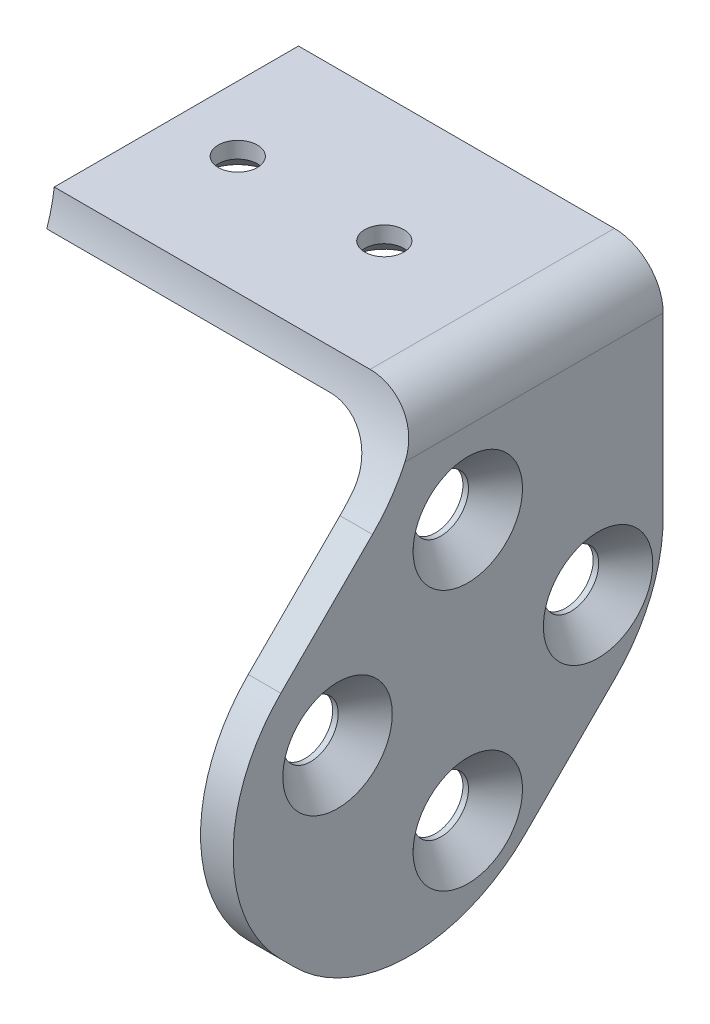
from build123d import *

# Parameters (mm, degrees)
ESBO_O1_W                                    = 22.4
ESBO_O1_H                                    = 15
RESSALTO_EXTRUS_O1_DEPTH                     = 2
ESBO_O9_W                                    = 2
ESBO_O9_H                                    = 15
RESSALTO_EXTRUS_O2_DEPTH                     = 1
INCLINA_O2_ANGLE                             = 45
ESBO_O11_W                                   = 2
ESBO_O11_H                                   = 21.213203436
RESSALTO_EXTRUS_O4_DEPTH                     = 22
FILETE1_START                                = 20.4
FILETE1_DEPTH                                = 2
FILETE1_2_DEPTH                              = 22.4
FILETE1_3_DEPTH                              = 2
ESCAREADO_PARA_SFHCS_M31_D                   = 3.4
ESCAREADO_PARA_SFHCS_M31_DEPTH               = 7.5
ESCAREADO_PARA_SFHCS_M31_CSINK_D             = 6.72
ESCAREADO_PARA_SFHCS_M31_CSINK_ANGLE         = 90
ESCAREADO_PARA_SFHCS_M31_TIP                 = 1.021463052
FILETE2_R                                    = 3
ESCAREADO_PARA_PARAFUSO_COM_CABE_A_E_2_COUNT = 2
ESCAREADO_PARA_PARAFUSO_COM_CABE_A_E_2_PITCH = 9


with BuildPart() as part:
    # Esboço1 → Ressalto-extrusão1 (new body)
    with BuildSketch(Plane(origin=(0, 0, 0), x_dir=(1, 0, 0), z_dir=(0, 1, 0))):
        with Locations((11.2, 7.5)):
            Rectangle(ESBO_O1_W, ESBO_O1_H)
    extrude(amount=RESSALTO_EXTRUS_O1_DEPTH)

    # Esboço9 → Ressalto-extrusão2 (add)
    with BuildSketch(Plane.XZ):
        with Locations((21.4, -7.5)):
            Rectangle(ESBO_O9_W, ESBO_O9_H)
    extrude(amount=RESSALTO_EXTRUS_O2_DEPTH)

    # Inclinação2
    inclina_o2_faces = [part.faces().sort_by_distance(p)[0] for p in [
        (21.4, -1, -7.5),
    ]]
    draft(inclina_o2_faces, Plane(origin=(0, 2, 0), x_dir=(1, 0, 0), z_dir=(0, 0, 1)), INCLINA_O2_ANGLE)

    # Esboço11 → Ressalto-extrusão4 (add)
    with BuildSketch(Plane(origin=(0, -0.5, 0.5), x_dir=(1, 0, 0), z_dir=(0, -0.7071067811865462, 0.7071067811865488))):
        with Locations((21.4, -11.313708499)):
            Rectangle(ESBO_O11_W, ESBO_O11_H)
    extrude(amount=RESSALTO_EXTRUS_O4_DEPTH)

    # Filete1: read off the stored shape, not the designer's step
    # Filete1 outline → Filete1 (cut)
    with BuildSketch(Plane.YZ.offset(FILETE1_START)):
        with BuildLine():
            ThreePointArc((-23.627416998, 8.485281374), (-16.556349186, 11.414213562), (-9.485281374, 8.485281374))
            Line((-9.485281374, 8.485281374), (-16.556349186, 15.556349186))
            Line((-16.556349186, 15.556349186), (-23.627416998, 8.485281374))
        make_face()
        with BuildLine():
            Line((-16, -15), (-11.857864376, -15))
            ThreePointArc((-11.857864376, -15), (-15.6846987, -14.238795325), (-18.928932188, -12.071067812))
            Line((-18.928932188, -12.071067812), (-16, -15))
        make_face()
        with BuildLine():
            ThreePointArc((-24.485281374, -6.514718626), (-27.414213562, 0.556349186), (-24.485281374, 7.627416998))
            Line((-24.485281374, 7.627416998), (-31.556349186, 0.556349186))
            Line((-31.556349186, 0.556349186), (-24.485281374, -6.514718626))
        make_face()
    extrude(amount=FILETE1_DEPTH, mode=Mode.SUBTRACT)

    # Filete1 2 outline → Filete1 2 (add)
    with BuildSketch(Plane.YZ):
        with BuildLine():
            Line((0, 0), (2, 0))
            ThreePointArc((2, 0), (0.988246282, 0.177135355), (0, 0.457120724))
            Line((0, 0.457120724), (0, 0))
        make_face()
    extrude(amount=FILETE1_2_DEPTH)

    # Filete1 3 outline → Filete1 3 (add)
    with BuildSketch(Plane.YZ.offset(FILETE1_START)):
        with BuildLine():
            Line((0, 0), (0, 0.457120724))
            ThreePointArc((0, 0.457120724), (-2.065182242, 1.434278965), (-3.854676043, 2.854676043))
            Line((-3.854676043, 2.854676043), (-1, 0))
            Line((-1, 0), (0, 0))
        make_face()
    extrude(amount=FILETE1_3_DEPTH)

    # Escareado para SFHCS M31
    with Locations(Plane(origin=(22.4, 0, 0), x_dir=(0, 0, -1), z_dir=(1, 0, 0))):
        with Locations((3, -6), (11, -14), (3, -22), (-5, -14)):
            CounterSinkHole(ESCAREADO_PARA_SFHCS_M31_D / 2, ESCAREADO_PARA_SFHCS_M31_CSINK_D / 2, depth=ESCAREADO_PARA_SFHCS_M31_DEPTH, counter_sink_angle=ESCAREADO_PARA_SFHCS_M31_CSINK_ANGLE)
            with Locations((0, 0, -(ESCAREADO_PARA_SFHCS_M31_DEPTH + ESCAREADO_PARA_SFHCS_M31_TIP / 2))):  # 118° drill point
                Cone(0, ESCAREADO_PARA_SFHCS_M31_D / 2, ESCAREADO_PARA_SFHCS_M31_TIP, mode=Mode.SUBTRACT)

    # Filete2
    # the kernel refuses this fillet: 3 mm, written as the material it adds along each edge
    with BuildSketch(Plane(origin=(20.4, 0, -15), x_dir=(-1, 0, 0), z_dir=(0, 0, 1))) as filete2_piece_1_section:
        with BuildLine():
            CenterArc((FILETE2_R, FILETE2_R), FILETE2_R, 180, 90)
            Line((0, FILETE2_R), (0, 0))
            Line((0, 0), (FILETE2_R, 0))
        make_face()
    filete2_piece_1 = extrude(amount=22.957120724, mode=Mode.PRIVATE)
    filete2_piece_1 = filete2_piece_1 - Plane(origin=(20.4, 3.216391795, 9.925743967), x_dir=(0, -0.12163917811992071, -0.9925743852962912), z_dir=(-1, 0, 0)) * Cylinder(10.000000115, 58, mode=Mode.PRIVATE)
    add(filete2_piece_1)
    # the kernel refuses this fillet: 3 mm, written as the material it takes off along each edge
    with BuildSketch(Plane(origin=(22.4, 2, 7.5), x_dir=(-1, 0, 0), z_dir=(0, 0, -1))) as filete2_2_piece_1:
        with BuildLine():
            CenterArc((FILETE2_R, -FILETE2_R), FILETE2_R, 90, 90)
            Line((0, -FILETE2_R), (0, 0))
            Line((0, 0), (FILETE2_R, 0))
        make_face()
    extrude(amount=30, mode=Mode.SUBTRACT)

    # Esboço16 → Escareado para parafuso com cabeça escareada elevada de M21 (revolve, cut)
    with BuildSketch(Plane(origin=(4, 0, -7.271439638), x_dir=(0, 0, -1), z_dir=(1, 0, 0))):
        Polygon((0, 0), (0, 2), (1.2, 2), (1.2, 1), (2.2, 0), align=None)
    escareado_para_parafuso_com_cabe_a_escar = revolve(axis=Axis((4, -6.35, -7.271439638), (0, 1, 0)), mode=Mode.SUBTRACT)

    # Escareado para parafuso com cabe_a e 2: Escareado para parafuso com cabeça escareada elevada de M21 ×2
    with Locations(*[(i * ESCAREADO_PARA_PARAFUSO_COM_CABE_A_E_2_PITCH, 0, 0) for i in range(1, ESCAREADO_PARA_PARAFUSO_COM_CABE_A_E_2_COUNT)]):
        add(escareado_para_parafuso_com_cabe_a_escar, mode=Mode.SUBTRACT)


solid = part.part
